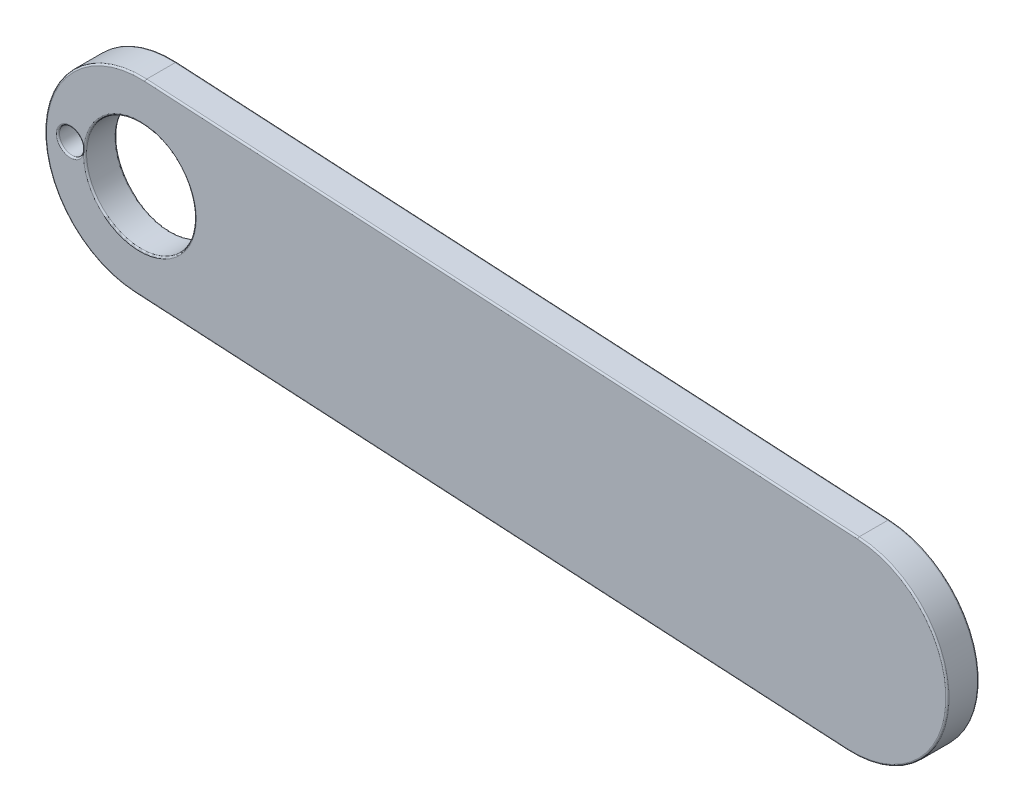
from build123d import *

# Parameters (mm, degrees)
SKETCH1_R           = 11
SKETCH1_R_2         = 2.499999953
BOSS_EXTRUDE1_DEPTH = 6.35
FILLET1_R           = 0.3175


with BuildPart() as part:
    # Sketch1 → Boss-Extrude1 (new body)
    with BuildSketch(Plane.XY):
        with BuildLine():
            Line((1.067348026, 19.020075399), (144.069348026, 10.995243779))
            ThreePointArc((144.069348026, 10.995243779), (162.022075399, -9.092179646), (141.934651974, -27.044907019))
            Line((141.934651974, -27.044907019), (-1.067348026, -19.020075399))
            ThreePointArc((-1.067348026, -19.020075399), (-19.020075399, 1.067348026), (1.067348026, 19.020075399))
        make_face()
        Circle(SKETCH1_R, mode=Mode.SUBTRACT)
        with Locations((-13.948055293, 0.782721886)):
            Circle(SKETCH1_R_2, mode=Mode.SUBTRACT)
    extrude(amount=BOSS_EXTRUDE1_DEPTH)

    # Fillet1
    # the kernel refuses this fillet: 0.3175 mm, written as the material it takes off along each edge
    with BuildSketch(Plane(origin=(143.002, -8.02483162, 6.35), x_dir=(0.05602876779124647, 0.9984291548125959, 0), z_dir=(-0.9984291548125959, 0.05602876779124647, 0))) as fillet1_piece_1:
        with BuildLine():
            CenterArc((19.05 - FILLET1_R, FILLET1_R), FILLET1_R, 270, 90)
            Line((19.05 - FILLET1_R, 0), (19.05, 0))
            Line((19.05, 0), (19.05, FILLET1_R))
        make_face()
    revolve(axis=Axis((143.002, -8.02483162, 6.35), (0, 0, -1)), revolution_arc=180, mode=Mode.SUBTRACT)
    with BuildSketch(Plane(origin=(0, 0, 0), x_dir=(1, 0, 0), z_dir=(0, -1, 0))) as fillet1_piece_2:
        with BuildLine():
            CenterArc((11 + FILLET1_R, FILLET1_R), FILLET1_R, 180, 90)
            Line((11 + FILLET1_R, 0), (11, 0))
            Line((11, 0), (11, FILLET1_R))
        make_face()
    revolve(axis=Axis((0, 0, 0), (0, 0, 1)), mode=Mode.SUBTRACT)
    with BuildSketch(Plane(origin=(0, 0, 6.35), x_dir=(1, 0, 0), z_dir=(0, -1, 0))) as fillet1_piece_3:
        with BuildLine():
            CenterArc((11 + FILLET1_R, -FILLET1_R), FILLET1_R, 90, 90)
            Line((11 + FILLET1_R, 0), (11, 0))
            Line((11, 0), (11, -FILLET1_R))
        make_face()
    revolve(axis=Axis((0, 0, 6.35), (0, 0, 1)), mode=Mode.SUBTRACT)
    with BuildSketch(Plane(origin=(1.067348026, 19.020075399, 6.35), x_dir=(0, 0, -1), z_dir=(0.998429154812596, -0.056028767791246756, 0)), Plane(origin=(141.934651974, -27.044907019, 6.35), x_dir=(0, 0, -1), z_dir=(-0.998429154812596, 0.05602876779124666, 0))) as fillet1_piece_4:
        with BuildLine():
            CenterArc((FILLET1_R, -FILLET1_R), FILLET1_R, 90, 90)
            Line((0, -FILLET1_R), (0, 0))
            Line((0, 0), (FILLET1_R, 0))
        make_face()
    extrude(amount=143.226987424, mode=Mode.SUBTRACT)
    with BuildSketch(Plane(origin=(-13.948055293, 0.782721886, 0), x_dir=(1, 0, 0), z_dir=(0, -1, 0))) as fillet1_piece_5:
        with BuildLine():
            CenterArc((2.499999953 + FILLET1_R, FILLET1_R), FILLET1_R, 180, 90)
            Line((2.499999953 + FILLET1_R, 0), (2.499999953, 0))
            Line((2.499999953, 0), (2.499999953, FILLET1_R))
        make_face()
    revolve(axis=Axis((-13.948055293, 0.782721886, 0), (0, 0, 1)), mode=Mode.SUBTRACT)
    with BuildSketch(Plane(origin=(-13.948055293, 0.782721886, 6.35), x_dir=(1, 0, 0), z_dir=(0, -1, 0))) as fillet1_piece_6:
        with BuildLine():
            CenterArc((2.499999953 + FILLET1_R, -FILLET1_R), FILLET1_R, 90, 90)
            Line((2.499999953 + FILLET1_R, 0), (2.499999953, 0))
            Line((2.499999953, 0), (2.499999953, -FILLET1_R))
        make_face()
    revolve(axis=Axis((-13.948055293, 0.782721886, 6.35), (0, 0, 1)), mode=Mode.SUBTRACT)
    with BuildSketch(Plane(origin=(0, 0, 6.35), x_dir=(-0.05602876779124687, -0.9984291548125959, 0), z_dir=(0.9984291548125959, -0.05602876779124687, 0))) as fillet1_piece_7:
        with BuildLine():
            CenterArc((19.05 - FILLET1_R, FILLET1_R), FILLET1_R, 270, 90)
            Line((19.05 - FILLET1_R, 0), (19.05, 0))
            Line((19.05, 0), (19.05, FILLET1_R))
        make_face()
    revolve(axis=Axis((0, 0, 6.35), (0, 0, -1)), revolution_arc=180, mode=Mode.SUBTRACT)
    with BuildSketch(Plane(origin=(1.067348026, 19.020075399, 0), x_dir=(0, 0, 1), z_dir=(0.998429154812596, -0.056028767791246756, 0)), Plane(origin=(141.934651974, -27.044907019, 0), x_dir=(0, 0, 1), z_dir=(-0.998429154812596, 0.05602876779124666, 0))) as fillet1_piece_8:
        with BuildLine():
            CenterArc((FILLET1_R, FILLET1_R), FILLET1_R, 180, 90)
            Line((0, FILLET1_R), (0, 0))
            Line((0, 0), (FILLET1_R, 0))
        make_face()
    extrude(amount=143.226987424, mode=Mode.SUBTRACT)
    with BuildSketch(Plane(origin=(143.002, -8.02483162, 0), x_dir=(0.05602876779124647, 0.9984291548125959, 0), z_dir=(-0.9984291548125959, 0.05602876779124647, 0))) as fillet1_piece_9:
        with BuildLine():
            CenterArc((19.05 - FILLET1_R, -FILLET1_R), FILLET1_R, 0, 90)
            Line((19.05 - FILLET1_R, 0), (19.05, 0))
            Line((19.05, 0), (19.05, -FILLET1_R))
        make_face()
    revolve(axis=Axis((143.002, -8.02483162, 0), (0, 0, -1)), revolution_arc=180, mode=Mode.SUBTRACT)
    with BuildSketch(Plane(origin=(0, 0, 0), x_dir=(-0.05602876779124687, -0.9984291548125959, 0), z_dir=(0.9984291548125959, -0.05602876779124687, 0))) as fillet1_piece_10:
        with BuildLine():
            CenterArc((19.05 - FILLET1_R, -FILLET1_R), FILLET1_R, 0, 90)
            Line((19.05 - FILLET1_R, 0), (19.05, 0))
            Line((19.05, 0), (19.05, -FILLET1_R))
        make_face()
    revolve(axis=Axis((0, 0, 0), (0, 0, -1)), revolution_arc=180, mode=Mode.SUBTRACT)


solid = part.part
